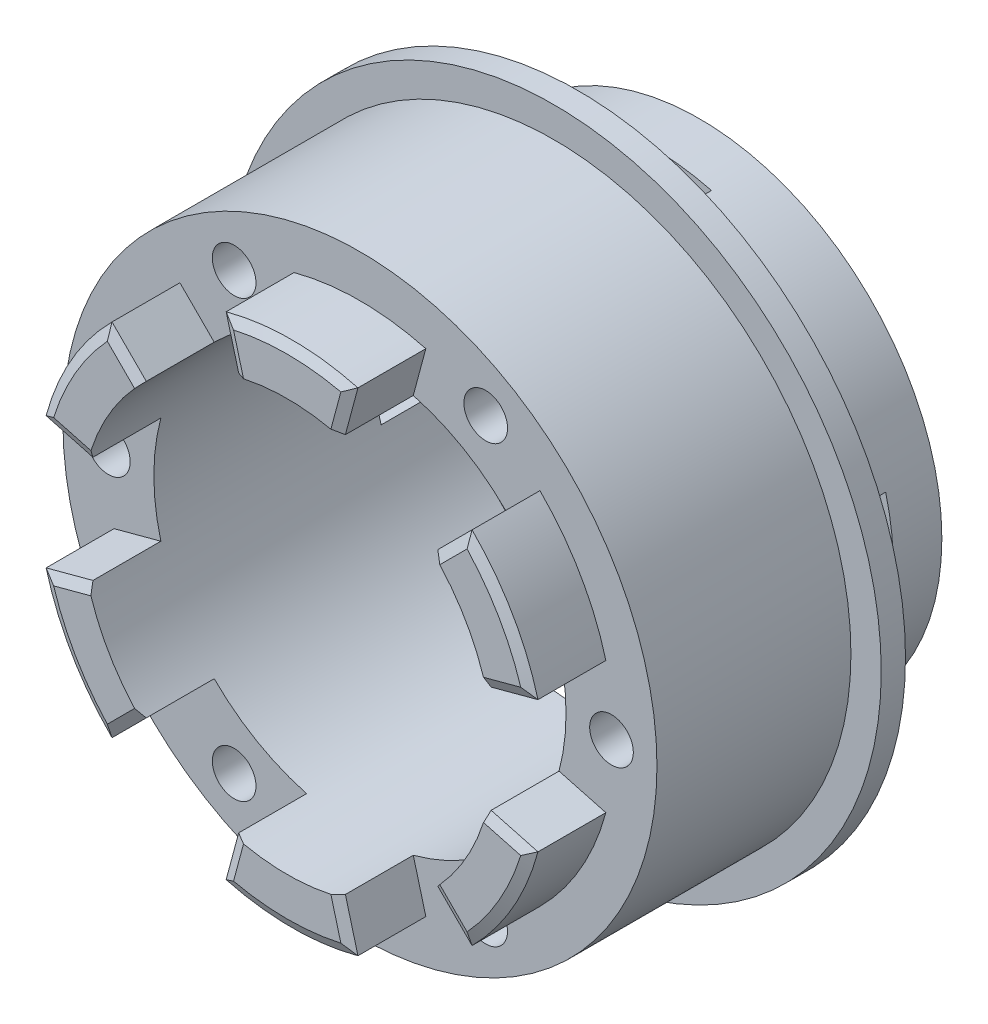
from build123d import *
from OCP.BRepFilletAPI import BRepFilletAPI_MakeChamfer

# Parameters (mm, degrees)
SKETCH_1_R               = 10
EXTRUDE_1_DEPTH          = 2
SKETCH_2_R               = 10
SKETCH_2_R_2             = 8.5
EXTRUDE_2_DEPTH          = 3
SKETCH_4_R               = 13.5
SKETCH_4_R_2             = 8.5
EXTRUDE_3_DEPTH          = 1
SKETCH_5_R               = 12.25
SKETCH_5_R_2             = 8.5
EXTRUDE_4_DEPTH          = 8
SKETCH_6_R               = 0.9
CUT_EXTRUDE_1_DEPTH      = 8
SKETCH_7_R               = 3
SKETCH_7_R_2             = 1.15
CUT_EXTRUDE_2_DEPTH      = 24.674881204
CUT_EXTRUDE_3_DEPTH      = 24.674881204
CUT_EXTRUDE_3_DEPTH_BACK = 24.674881204
SKETCH_8_W               = 5
SKETCH_8_H               = 3
CUT_EXTRUDE_4_DEPTH      = 24.674881204
CUT_EXTRUDE_4_DEPTH_BACK = 24.674881204
SKETCH_9_W               = 3
SKETCH_9_H               = 5
EXTRUDE_5_DEPTH          = 3
CHAMFER_1_SIZE           = 0.2
CHAMFER_1_SIZE2          = 0.410060768


with BuildPart() as part:
    # 스케치1 → 보스-돌출1 (new body)
    with BuildSketch(Plane.XY):
        Circle(SKETCH_1_R)
    extrude(amount=EXTRUDE_1_DEPTH)

    # 스케치2 → 보스-돌출2 (add)
    with BuildSketch(Plane.XY.offset(2)):
        Circle(SKETCH_2_R)
        Circle(SKETCH_2_R_2, mode=Mode.SUBTRACT)
    extrude(amount=EXTRUDE_2_DEPTH)

    # 스케치4 → 보스-돌출3 (add)
    with BuildSketch(Plane.XY.offset(5)):
        Circle(SKETCH_4_R)
        Circle(SKETCH_4_R_2, mode=Mode.SUBTRACT)
    extrude(amount=EXTRUDE_3_DEPTH)

    # 스케치5 → 보스-돌출4 (add)
    with BuildSketch(Plane.XY.offset(6)):
        Circle(SKETCH_5_R)
        Circle(SKETCH_5_R_2, mode=Mode.SUBTRACT)
    extrude(amount=EXTRUDE_4_DEPTH)

    # 스케치6 → 컷-돌출1 (cut)
    with BuildSketch(Plane.XY.offset(14)):
        with Locations((10.375, 0)):
            Circle(SKETCH_6_R)
        with Locations((5.1875, -8.985013564)):
            Circle(SKETCH_6_R)
        with Locations((-5.1875, -8.985013564)):
            Circle(SKETCH_6_R)
        with Locations((-10.375, 0)):
            Circle(SKETCH_6_R)
        with Locations((-5.1875, 8.985013564)):
            Circle(SKETCH_6_R)
        with Locations((5.1875, 8.985013564)):
            Circle(SKETCH_6_R)
    extrude(amount=-CUT_EXTRUDE_1_DEPTH, mode=Mode.SUBTRACT)

    # 스케치7 → 컷-돌출2 (cut, through all)
    with BuildSketch(Plane(origin=(0, 0, 0), x_dir=(-1, 0, 0), z_dir=(0, 0, -1))):
        Circle(SKETCH_7_R)
        with Locations((-7, 0)):
            Circle(SKETCH_7_R_2)
        with Locations((7, 0)):
            Circle(SKETCH_7_R_2)
        with Locations((0, 7)):
            Circle(SKETCH_7_R_2)
        with Locations((0, -7)):
            Circle(SKETCH_7_R_2)
    extrude(amount=-CUT_EXTRUDE_2_DEPTH, mode=Mode.SUBTRACT)

    # 스케치8 → 컷-돌출3 (cut, two sides: drawn at the far end of the back side and taken through both)
    with BuildSketch(Plane(origin=(0, 0, 0), x_dir=(1, 0, 0), z_dir=(0, 1, 0)).offset(-CUT_EXTRUDE_3_DEPTH_BACK)):
        with Locations((0, -3.5)):
            Rectangle(SKETCH_8_W, SKETCH_8_H)
    extrude(amount=CUT_EXTRUDE_3_DEPTH + CUT_EXTRUDE_3_DEPTH_BACK, mode=Mode.SUBTRACT)

    # 스케치9 → 컷-돌출4 (cut, two sides: drawn at the far end of the back side and taken through both)
    with BuildSketch(Plane(origin=(0, 0, 0), x_dir=(0, 0, -1), z_dir=(1, 0, 0)).offset(-CUT_EXTRUDE_4_DEPTH_BACK)):
        with Locations((-3.5, 0)):
            Rectangle(SKETCH_9_W, SKETCH_9_H)
    extrude(amount=CUT_EXTRUDE_4_DEPTH + CUT_EXTRUDE_4_DEPTH_BACK, mode=Mode.SUBTRACT)

    # 스케치10 → 보스-돌출5 (add)
    with BuildSketch(Plane.XY.offset(14)):
        with BuildLine():
            Line((2.199961883, 8.210369523), (2.717599974, 10.142221176))
            ThreePointArc((2.717599974, 10.142221176), (0, 10.5), (-2.717599974, 10.142221176))
            Line((-2.717599974, 10.142221176), (-2.199961883, 8.210369523))
            ThreePointArc((-2.199961883, 8.210369523), (0, 8.5), (2.199961883, 8.210369523))
        make_face()
        with BuildLine():
            Line((6.01040764, 6.01040764), (7.424621202, 7.424621202))
            ThreePointArc((7.424621202, 7.424621202), (9.09326674, 5.25), (10.142221176, 2.717599974))
            Line((10.142221176, 2.717599974), (8.210369523, 2.199961883))
            ThreePointArc((8.210369523, 2.199961883), (7.361215932, 4.25), (6.01040764, 6.01040764))
        make_face()
        with BuildLine():
            Line((8.210369523, -2.199961883), (10.142221176, -2.717599974))
            ThreePointArc((10.142221176, -2.717599974), (9.09326674, -5.25), (7.424621202, -7.424621202))
            Line((7.424621202, -7.424621202), (6.01040764, -6.01040764))
            ThreePointArc((6.01040764, -6.01040764), (7.361215932, -4.25), (8.210369523, -2.199961883))
        make_face()
        with BuildLine():
            Line((2.199961883, -8.210369523), (2.717599974, -10.142221176))
            ThreePointArc((2.717599974, -10.142221176), (0, -10.5), (-2.717599974, -10.142221176))
            Line((-2.717599974, -10.142221176), (-2.199961883, -8.210369523))
            ThreePointArc((-2.199961883, -8.210369523), (0, -8.5), (2.199961883, -8.210369523))
        make_face()
        with BuildLine():
            Line((-6.01040764, -6.01040764), (-7.424621202, -7.424621202))
            ThreePointArc((-7.424621202, -7.424621202), (-9.09326674, -5.25), (-10.142221176, -2.717599974))
            Line((-10.142221176, -2.717599974), (-8.210369523, -2.199961883))
            ThreePointArc((-8.210369523, -2.199961883), (-7.361215932, -4.25), (-6.01040764, -6.01040764))
        make_face()
        with BuildLine():
            Line((-8.210369523, 2.199961883), (-10.142221176, 2.717599974))
            ThreePointArc((-10.142221176, 2.717599974), (-9.09326674, 5.25), (-7.424621202, 7.424621202))
            Line((-7.424621202, 7.424621202), (-6.01040764, 6.01040764))
            ThreePointArc((-6.01040764, 6.01040764), (-7.361215932, 4.25), (-8.210369523, 2.199961883))
        make_face()
    extrude(amount=EXTRUDE_5_DEPTH)

    # 모따기1: one chamfer whose edges measure the first distance from different faces: ONE call of the kernel's chamfer builder (chamfer() names one face for all edges)
    chamfer_1_edges_1 = [part.edges().sort_by_distance(p)[0] for p in [
        (-9.17629535, -2.458780928, 17),
    ]]
    chamfer_1_side_1 = [part.faces().sort_by_distance(p)[0] for p in [
        (-9.17629535, -2.458780928, 15.5),
    ]]
    chamfer_1_edges_2 = [part.edges().sort_by_distance(p)[0] for p in [
        (-6.717514421, -6.717514421, 17),
    ]]
    chamfer_1_side_2 = [part.faces().sort_by_distance(p)[0] for p in [
        (-6.717514421, -6.717514421, 15.5),
    ]]
    chamfer_1_edges_3 = [part.edges().sort_by_distance(p)[0] for p in [
        (-2.458780928, -9.17629535, 17),
    ]]
    chamfer_1_side_3 = [part.faces().sort_by_distance(p)[0] for p in [
        (-2.458780928, -9.17629535, 15.5),
    ]]
    chamfer_1_edges_4 = [part.edges().sort_by_distance(p)[0] for p in [
        (2.458780928, -9.17629535, 17),
    ]]
    chamfer_1_side_4 = [part.faces().sort_by_distance(p)[0] for p in [
        (2.458780928, -9.17629535, 15.5),
    ]]
    chamfer_1_edges_5 = [part.edges().sort_by_distance(p)[0] for p in [
        (6.717514421, -6.717514421, 17),
    ]]
    chamfer_1_side_5 = [part.faces().sort_by_distance(p)[0] for p in [
        (6.717514421, -6.717514421, 15.5),
    ]]
    chamfer_1_edges_6 = [part.edges().sort_by_distance(p)[0] for p in [
        (9.17629535, -2.458780928, 17),
    ]]
    chamfer_1_side_6 = [part.faces().sort_by_distance(p)[0] for p in [
        (9.17629535, -2.458780928, 15.5),
    ]]
    chamfer_1_edges_7 = [part.edges().sort_by_distance(p)[0] for p in [
        (9.17629535, 2.458780928, 17),
    ]]
    chamfer_1_side_7 = [part.faces().sort_by_distance(p)[0] for p in [
        (9.17629535, 2.458780928, 15.5),
    ]]
    chamfer_1_edges_8 = [part.edges().sort_by_distance(p)[0] for p in [
        (6.717514421, 6.717514421, 17),
    ]]
    chamfer_1_side_8 = [part.faces().sort_by_distance(p)[0] for p in [
        (6.717514421, 6.717514421, 15.5),
    ]]
    chamfer_1_edges_9 = [part.edges().sort_by_distance(p)[0] for p in [
        (2.458780928, 9.17629535, 17),
    ]]
    chamfer_1_side_9 = [part.faces().sort_by_distance(p)[0] for p in [
        (2.458780928, 9.17629535, 15.5),
    ]]
    chamfer_1_edges_10 = [part.edges().sort_by_distance(p)[0] for p in [
        (-2.458780928, 9.17629535, 17),
    ]]
    chamfer_1_side_10 = [part.faces().sort_by_distance(p)[0] for p in [
        (-2.458780928, 9.17629535, 15.5),
    ]]
    chamfer_1_edges_11 = [part.edges().sort_by_distance(p)[0] for p in [
        (-6.717514421, 6.717514421, 17),
    ]]
    chamfer_1_side_11 = [part.faces().sort_by_distance(p)[0] for p in [
        (-6.717514421, 6.717514421, 15.5),
    ]]
    chamfer_1_edges_12 = [part.edges().sort_by_distance(p)[0] for p in [
        (-9.17629535, 2.458780928, 17),
    ]]
    chamfer_1_side_12 = [part.faces().sort_by_distance(p)[0] for p in [
        (-9.17629535, 2.458780928, 15.5),
    ]]
    chamfer_1_edges_13 = [part.edges().sort_by_distance(p)[0] for p in [
        (-9.09326674, -5.25, 17),
    ]]
    chamfer_1_side_13 = [part.faces().sort_by_distance(p)[0] for p in [
        (-9.09326674, -5.25, 15.5),
    ]]
    chamfer_1_edges_14 = [part.edges().sort_by_distance(p)[0] for p in [
        (0, -10.5, 17),
    ]]
    chamfer_1_side_14 = [part.faces().sort_by_distance(p)[0] for p in [
        (0, -10.5, 15.5),
    ]]
    chamfer_1_edges_15 = [part.edges().sort_by_distance(p)[0] for p in [
        (9.09326674, -5.25, 17),
    ]]
    chamfer_1_side_15 = [part.faces().sort_by_distance(p)[0] for p in [
        (9.09326674, -5.25, 15.5),
    ]]
    chamfer_1_edges_16 = [part.edges().sort_by_distance(p)[0] for p in [
        (9.09326674, 5.25, 17),
    ]]
    chamfer_1_side_16 = [part.faces().sort_by_distance(p)[0] for p in [
        (9.09326674, 5.25, 15.5),
    ]]
    chamfer_1_edges_17 = [part.edges().sort_by_distance(p)[0] for p in [
        (0, 10.5, 17),
    ]]
    chamfer_1_side_17 = [part.faces().sort_by_distance(p)[0] for p in [
        (0, 10.5, 15.5),
    ]]
    chamfer_1_edges_18 = [part.edges().sort_by_distance(p)[0] for p in [
        (-9.09326674, 5.25, 17),
    ]]
    chamfer_1_side_18 = [part.faces().sort_by_distance(p)[0] for p in [
        (-9.09326674, 5.25, 15.5),
    ]]
    chamfer_1 = BRepFilletAPI_MakeChamfer(part.part.solid().wrapped)
    for e in chamfer_1_edges_1:
        chamfer_1.Add(CHAMFER_1_SIZE, CHAMFER_1_SIZE2, e.wrapped, chamfer_1_side_1[0].wrapped)  # the first distance lies on this face
    for e in chamfer_1_edges_2:
        chamfer_1.Add(CHAMFER_1_SIZE, CHAMFER_1_SIZE2, e.wrapped, chamfer_1_side_2[0].wrapped)  # the first distance lies on this face
    for e in chamfer_1_edges_3:
        chamfer_1.Add(CHAMFER_1_SIZE, CHAMFER_1_SIZE2, e.wrapped, chamfer_1_side_3[0].wrapped)  # the first distance lies on this face
    for e in chamfer_1_edges_4:
        chamfer_1.Add(CHAMFER_1_SIZE, CHAMFER_1_SIZE2, e.wrapped, chamfer_1_side_4[0].wrapped)  # the first distance lies on this face
    for e in chamfer_1_edges_5:
        chamfer_1.Add(CHAMFER_1_SIZE, CHAMFER_1_SIZE2, e.wrapped, chamfer_1_side_5[0].wrapped)  # the first distance lies on this face
    for e in chamfer_1_edges_6:
        chamfer_1.Add(CHAMFER_1_SIZE, CHAMFER_1_SIZE2, e.wrapped, chamfer_1_side_6[0].wrapped)  # the first distance lies on this face
    for e in chamfer_1_edges_7:
        chamfer_1.Add(CHAMFER_1_SIZE, CHAMFER_1_SIZE2, e.wrapped, chamfer_1_side_7[0].wrapped)  # the first distance lies on this face
    for e in chamfer_1_edges_8:
        chamfer_1.Add(CHAMFER_1_SIZE, CHAMFER_1_SIZE2, e.wrapped, chamfer_1_side_8[0].wrapped)  # the first distance lies on this face
    for e in chamfer_1_edges_9:
        chamfer_1.Add(CHAMFER_1_SIZE, CHAMFER_1_SIZE2, e.wrapped, chamfer_1_side_9[0].wrapped)  # the first distance lies on this face
    for e in chamfer_1_edges_10:
        chamfer_1.Add(CHAMFER_1_SIZE, CHAMFER_1_SIZE2, e.wrapped, chamfer_1_side_10[0].wrapped)  # the first distance lies on this face
    for e in chamfer_1_edges_11:
        chamfer_1.Add(CHAMFER_1_SIZE, CHAMFER_1_SIZE2, e.wrapped, chamfer_1_side_11[0].wrapped)  # the first distance lies on this face
    for e in chamfer_1_edges_12:
        chamfer_1.Add(CHAMFER_1_SIZE, CHAMFER_1_SIZE2, e.wrapped, chamfer_1_side_12[0].wrapped)  # the first distance lies on this face
    for e in chamfer_1_edges_13:
        chamfer_1.Add(CHAMFER_1_SIZE, CHAMFER_1_SIZE2, e.wrapped, chamfer_1_side_13[0].wrapped)  # the first distance lies on this face
    for e in chamfer_1_edges_14:
        chamfer_1.Add(CHAMFER_1_SIZE, CHAMFER_1_SIZE2, e.wrapped, chamfer_1_side_14[0].wrapped)  # the first distance lies on this face
    for e in chamfer_1_edges_15:
        chamfer_1.Add(CHAMFER_1_SIZE, CHAMFER_1_SIZE2, e.wrapped, chamfer_1_side_15[0].wrapped)  # the first distance lies on this face
    for e in chamfer_1_edges_16:
        chamfer_1.Add(CHAMFER_1_SIZE, CHAMFER_1_SIZE2, e.wrapped, chamfer_1_side_16[0].wrapped)  # the first distance lies on this face
    for e in chamfer_1_edges_17:
        chamfer_1.Add(CHAMFER_1_SIZE, CHAMFER_1_SIZE2, e.wrapped, chamfer_1_side_17[0].wrapped)  # the first distance lies on this face
    for e in chamfer_1_edges_18:
        chamfer_1.Add(CHAMFER_1_SIZE, CHAMFER_1_SIZE2, e.wrapped, chamfer_1_side_18[0].wrapped)  # the first distance lies on this face
    add(Compound.cast(chamfer_1.Shape()), mode=Mode.REPLACE)


solid = part.part
